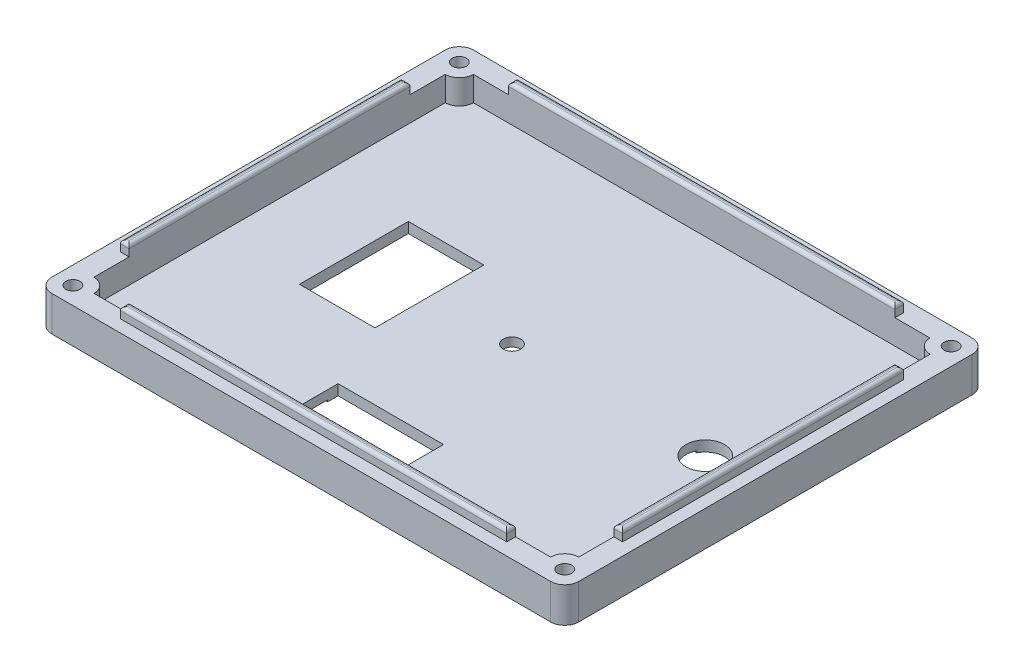
from build123d import *
from OCP.BRepFilletAPI import BRepFilletAPI_MakeChamfer

# Parameters (mm, degrees)
CROQUIS1_W              = 150
CROQUIS1_H              = 120
SALIENTE_EXTRUIR1_DEPTH = 10
CROQUIS2_W              = 143
CROQUIS2_H              = 113
SALIENTE_EXTRUIR2_DEPTH = 3
CORTAR_EXTRUIR4_DEPTH   = 10
CROQUIS5_W              = 20
CROQUIS5_H              = 20
CORTAR_EXTRUIR5_DEPTH   = 3
CROQUIS7_R              = 2
CORTAR_EXTRUIR6_DEPTH   = 97.566039579
CHAFL_N1_SIZE           = 4
CHAFL_N1_SIZE2          = 2.309401077
REDONDEO3_R             = 4
REDONDEO4_R             = 4
REDONDEO5_R             = 1
CROQUIS8_R              = 2.5
CROQUIS8_R_2            = 5.5
CROQUIS8_W              = 21.5
CROQUIS8_H              = 31
CROQUIS8_W_2            = 30
CROQUIS8_H_2            = 11
CORTAR_EXTRUIR7_DEPTH   = 97.922649572
CORTAR_EXTRUIR8_DEPTH   = 0.5


with BuildPart() as part:
    # Croquis1 → Saliente-Extruir1 (new body)
    with BuildSketch(Plane(origin=(0, 0, 0), x_dir=(1, 0, 0), z_dir=(0, 1, 0))):
        Rectangle(CROQUIS1_W, CROQUIS1_H)
    extrude(amount=SALIENTE_EXTRUIR1_DEPTH)

    # Croquis2 → Saliente-Extruir2 (add)
    with BuildSketch(Plane(origin=(0, 10, 0), x_dir=(1, 0, 0), z_dir=(0, 1, 0))):
        Rectangle(CROQUIS2_W, CROQUIS2_H)
    extrude(amount=SALIENTE_EXTRUIR2_DEPTH)

    # Croquis4 → Cortar-Extruir4 (cut)
    with BuildSketch(Plane(origin=(0, 13, 0), x_dir=(1, 0, 0), z_dir=(0, 1, 0))):
        Polygon((-65, 54), (65, 54), (65, 50), (69, 50), (69, -50), (65, -50), (65, -54), (-65, -54), (-65, -50), (-69, -50), (-69, 50), (-65, 50), align=None)
    extrude(amount=-CORTAR_EXTRUIR4_DEPTH, mode=Mode.SUBTRACT)

    # Croquis5 → Cortar-Extruir5 (cut)
    with BuildSketch(Plane(origin=(0, 13, 0), x_dir=(1, 0, 0), z_dir=(0, 1, 0))):
        with Locations((-65, 50)):
            Rectangle(CROQUIS5_W, CROQUIS5_H)
        with Locations((65, 50)):
            Rectangle(CROQUIS5_W, CROQUIS5_H)
        with Locations((65, -50)):
            Rectangle(CROQUIS5_W, CROQUIS5_H)
        with Locations((-65, -50)):
            Rectangle(CROQUIS5_W, CROQUIS5_H)
    extrude(amount=-CORTAR_EXTRUIR5_DEPTH, mode=Mode.SUBTRACT)

    # Croquis7 → Cortar-Extruir6 (cut, through all)
    with BuildSketch(Plane(origin=(0, 10, 0), x_dir=(1, 0, 0), z_dir=(0, 1, 0))):
        with Locations(Location((-70, 55, 0), (0, 0, 270))):
            Circle(CROQUIS7_R)
        with Locations(Location((70, 55, 0), (0, 0, 270))):
            Circle(CROQUIS7_R)
        with Locations(Location((70, -55, 0), (0, 0, 270))):
            Circle(CROQUIS7_R)
        with Locations(Location((-70, -55, 0), (0, 0, 270))):
            Circle(CROQUIS7_R)
    extrude(amount=-CORTAR_EXTRUIR6_DEPTH, mode=Mode.SUBTRACT)

    # Chaflán1: one chamfer whose edges measure the first distance from different faces: ONE call of the kernel's chamfer builder (chamfer() names one face for all edges)
    chafl_n1_edges_1 = [part.edges().sort_by_distance(p)[0] for p in [
        (70, 0, 53),
    ]]
    chafl_n1_side_1 = [part.faces().sort_by_distance(p)[0] for p in [
        (70, 5, 53),
    ]]
    chafl_n1_edges_2 = [part.edges().sort_by_distance(p)[0] for p in [
        (-70, 0, -57),
    ]]
    chafl_n1_side_2 = [part.faces().sort_by_distance(p)[0] for p in [
        (-70, 5, -57),
    ]]
    chafl_n1_edges_3 = [part.edges().sort_by_distance(p)[0] for p in [
        (-70, 0, 53),
    ]]
    chafl_n1_side_3 = [part.faces().sort_by_distance(p)[0] for p in [
        (-70, 5, 53),
    ]]
    chafl_n1_edges_4 = [part.edges().sort_by_distance(p)[0] for p in [
        (70, 0, -57),
    ]]
    chafl_n1_side_4 = [part.faces().sort_by_distance(p)[0] for p in [
        (70, 5, -57),
    ]]
    chafl_n1 = BRepFilletAPI_MakeChamfer(part.part.solid().wrapped)
    for e in chafl_n1_edges_1:
        chafl_n1.Add(CHAFL_N1_SIZE, CHAFL_N1_SIZE2, e.wrapped, chafl_n1_side_1[0].wrapped)  # the first distance lies on this face
    for e in chafl_n1_edges_2:
        chafl_n1.Add(CHAFL_N1_SIZE, CHAFL_N1_SIZE2, e.wrapped, chafl_n1_side_2[0].wrapped)  # the first distance lies on this face
    for e in chafl_n1_edges_3:
        chafl_n1.Add(CHAFL_N1_SIZE, CHAFL_N1_SIZE2, e.wrapped, chafl_n1_side_3[0].wrapped)  # the first distance lies on this face
    for e in chafl_n1_edges_4:
        chafl_n1.Add(CHAFL_N1_SIZE, CHAFL_N1_SIZE2, e.wrapped, chafl_n1_side_4[0].wrapped)  # the first distance lies on this face
    add(Compound.cast(chafl_n1.Shape()), mode=Mode.REPLACE)

    # Redondeo3
    redondeo3_edges = [part.edges().sort_by_distance(p)[0] for p in [
        (75, 5, 60),
        (-75, 5, 60),
        (-75, 5, -60),
        (75, 5, -60),
    ]]
    fillet(redondeo3_edges, radius=REDONDEO3_R)

    # Redondeo4
    redondeo4_edges = [part.edges().sort_by_distance(p)[0] for p in [
        (65, 6.5, -50),
        (65, 6.5, 50),
        (-65, 6.5, 50),
        (-65, 6.5, -50),
    ]]
    fillet(redondeo4_edges, radius=REDONDEO4_R - 0.0001)  # a hair under: the kernel refuses the full size

    # Redondeo5
    redondeo5_edges = [part.edges().sort_by_distance(p)[0] for p in [
        (70.25, 13, 40),
        (55, 13, 55.25),
        (55, 13, -55.25),
        (70.25, 13, -40),
        (-55, 13, -55.25),
        (-70.25, 13, -40),
        (0, 13, -54),
        (69, 13, 0),
        (0, 13, 54),
        (-69, 13, 0),
        (71.5, 13, 0),
        (0, 13, -56.5),
        (-71.5, 13, 0),
        (0, 13, 56.5),
        (-55, 13, 55.25),
        (-70.25, 13, 40),
    ]]
    fillet(redondeo5_edges, radius=REDONDEO5_R)

    # Croquis8 → Cortar-Extruir7 (cut, through all)
    with BuildSketch(Plane.XZ):
        with Locations(Location((0, 0, 0), (0, 0, 270))):
            Circle(CROQUIS8_R)
        with Locations(Location((55, 0, 0), (0, 0, 270))):
            Circle(CROQUIS8_R_2)
        with Locations((-34.25, 0)):
            Rectangle(CROQUIS8_W, CROQUIS8_H)
        with Locations((0, 40)):
            Rectangle(CROQUIS8_W_2, CROQUIS8_H_2)
    extrude(amount=-CORTAR_EXTRUIR7_DEPTH, mode=Mode.SUBTRACT)

    # Croquis9 → Cortar-Extruir8 (cut)
    with BuildSketch(Plane.XZ):
        Polygon((-23.5, 2.5), (-23.5, -2.5), (-12.5, -2.5), (-12.5, -12.5), (12.5, -12.5), (12.5, -2.5), (50.101020514, -2.5), (50.101020514, 2.5), (20.5, 2.5), (20.5, 42.5), (-20.5, 42.5), (-20.5, 2.5), align=None)
        Polygon((-12.5, 2.5), (-12.5, 12.5), (12.5, 12.5), (12.5, 2.5), (15.5, 2.5), (15.5, 37.5), (-15.5, 37.5), (-15.5, 2.5), align=None, mode=Mode.SUBTRACT)
    extrude(amount=-CORTAR_EXTRUIR8_DEPTH, mode=Mode.SUBTRACT)


solid = part.part
